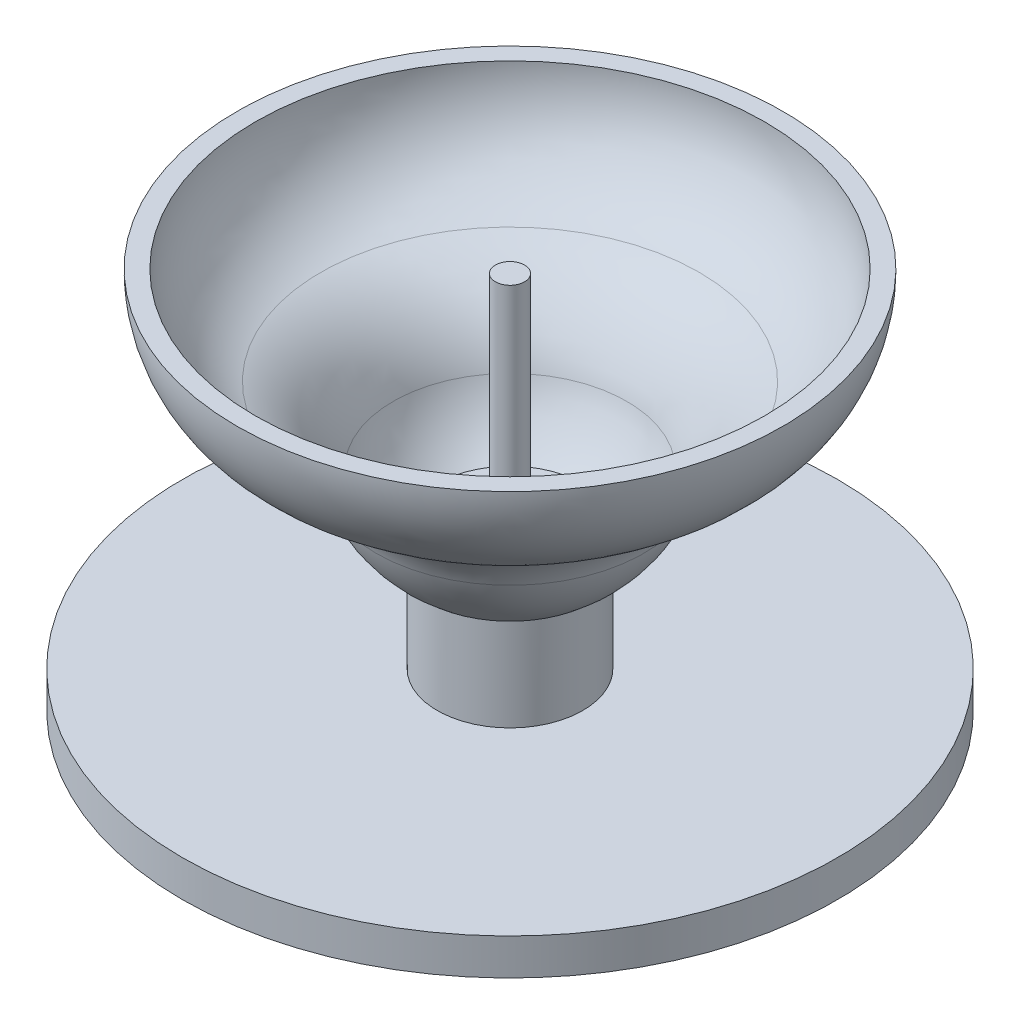
from build123d import *

# Parameters (mm, degrees)
ESQUISSE1_R                       = 90
BOSS_EXTRU_1_DEPTH                = 10
ESQUISSE2_R                       = 20
BOSS_EXTRU_2_DEPTH                = 93
ESQUISSE4_R                       = 39
ESQUISSE4_R_2                     = 36
ENL_V_MAT_EXTRU_1_DEPTH           = 1
ENL_V_MAT_EXTRU_1_DRAFT           = -30
ESQUISSE4_R_3                     = 57
ESQUISSE4_R_4                     = 54
ENL_V_MAT_EXTRU_1_PROFILE_2_DEPTH = 1
ENL_V_MAT_EXTRU_1_PROFILE_2_DRAFT = -30
ESQUISSE4_R_5                     = 75
ESQUISSE4_R_6                     = 72
ENL_V_MAT_EXTRU_1_PROFILE_3_DEPTH = 1
ENL_V_MAT_EXTRU_1_PROFILE_3_DRAFT = -30
ENL_V_START                       = -59
ESQUISSE5_R                       = 20
ENL_V_MAT_EXTRU_2_DEPTH           = 59
ESQUISSE6_R                       = 4
BOSS_EXTRU_3_DEPTH                = 60


with BuildPart() as part:
    # Esquisse1 → Boss.-Extru.1 (new body)
    with BuildSketch(Plane(origin=(0, 0, 0), x_dir=(1, 0, 0), z_dir=(0, 1, 0))):
        Circle(ESQUISSE1_R)
    extrude(amount=BOSS_EXTRU_1_DEPTH)

    # Esquisse2 → Boss.-Extru.2 (add)
    with BuildSketch(Plane(origin=(0, 10, 0), x_dir=(1, 0, 0), z_dir=(0, 1, 0))):
        Circle(ESQUISSE2_R)
    extrude(amount=BOSS_EXTRU_2_DEPTH)


with BuildPart() as enl_v_mat_extru_1_tool:
    # Esquisse4 → Enlèv. mat.-Extru.1 (with draft: the straight prism first)
    with BuildSketch(Plane.XZ):
        Circle(ESQUISSE4_R)
        Circle(ESQUISSE4_R_2, mode=Mode.SUBTRACT)
    extrude(amount=-ENL_V_MAT_EXTRU_1_DEPTH)
    # Enlèv. mat.-Extru.1: the draft: its side faces are tilted about the plane it starts from
    enl_v_mat_extru_1_sides = [enl_v_mat_extru_1_tool.faces().sort_by_distance(p)[0] for p in [
        (-39, 0.5, 0),
        (-36, 0.5, 0),
    ]]
    draft(enl_v_mat_extru_1_sides, Plane.XZ, ENL_V_MAT_EXTRU_1_DRAFT)


with BuildPart() as part_1:
    add(part.part)

    # Enlèv. mat.-Extru.1: cut by enl_v_mat_extru_1_tool
    add(enl_v_mat_extru_1_tool.part, mode=Mode.SUBTRACT)


with BuildPart() as enl_v_mat_extru_1_profile_2_tool:
    # Esquisse4 → Enlèv. mat.-Extru.1 profile 2 (with draft: the straight prism first)
    with BuildSketch(Plane.XZ):
        Circle(ESQUISSE4_R_3)
        Circle(ESQUISSE4_R_4, mode=Mode.SUBTRACT)
    extrude(amount=-ENL_V_MAT_EXTRU_1_PROFILE_2_DEPTH)
    # Enlèv. mat.-Extru.1 profile 2: the draft: its side faces are tilted about the plane it starts from
    enl_v_mat_extru_1_profile_2_sides = [enl_v_mat_extru_1_profile_2_tool.faces().sort_by_distance(p)[0] for p in [
        (-57, 0.5, 0),
        (-54, 0.5, 0),
    ]]
    draft(enl_v_mat_extru_1_profile_2_sides, Plane.XZ, ENL_V_MAT_EXTRU_1_PROFILE_2_DRAFT)


with BuildPart() as part_2:
    add(part_1.part)

    # Enlèv. mat.-Extru.1 profile 2: cut by enl_v_mat_extru_1_profile_2_tool
    add(enl_v_mat_extru_1_profile_2_tool.part, mode=Mode.SUBTRACT)


with BuildPart() as enl_v_mat_extru_1_profile_3_tool:
    # Esquisse4 → Enlèv. mat.-Extru.1 profile 3 (with draft: the straight prism first)
    with BuildSketch(Plane.XZ):
        Circle(ESQUISSE4_R_5)
        Circle(ESQUISSE4_R_6, mode=Mode.SUBTRACT)
    extrude(amount=-ENL_V_MAT_EXTRU_1_PROFILE_3_DEPTH)
    # Enlèv. mat.-Extru.1 profile 3: the draft: its side faces are tilted about the plane it starts from
    enl_v_mat_extru_1_profile_3_sides = [enl_v_mat_extru_1_profile_3_tool.faces().sort_by_distance(p)[0] for p in [
        (-75, 0.5, 0),
        (-72, 0.5, 0),
    ]]
    draft(enl_v_mat_extru_1_profile_3_sides, Plane.XZ, ENL_V_MAT_EXTRU_1_PROFILE_3_DRAFT)


with BuildPart() as part_3:
    add(part_2.part)

    # Enlèv. mat.-Extru.1 profile 3: cut by enl_v_mat_extru_1_profile_3_tool
    add(enl_v_mat_extru_1_profile_3_tool.part, mode=Mode.SUBTRACT)

    # Esquisse3 → Révolution2 (revolve)
    with BuildSketch(Plane(origin=(0, 0, 0), x_dir=(0, 0, -1), z_dir=(1, 0, 0))):
        with BuildLine():
            Line((-69.970754953, 105.094254483), (-74.970754953, 105.094254483))
            ThreePointArc((-74.970754953, 105.094254483), (-69.214189796, 86.164390325), (-53.893634743, 73.644071148))
            ThreePointArc((-53.893634743, 73.644071148), (-43.46448587, 66.535394214), (-36.80473888, 55.814004192))
            ThreePointArc((-36.80473888, 55.814004192), (-22.477497728, 37.096821257), (0, 30))
            Line((0, 30), (0, 35))
            ThreePointArc((0, 35), (-19.606403656, 41.190330611), (-32.103598704, 57.516731724))
            ThreePointArc((-32.103598704, 57.516731724), (-39.854721671, 69.995105534), (-51.992962878, 78.26872751))
            ThreePointArc((-51.992962878, 78.26872751), (-65.060675662, 88.947970814), (-69.970754953, 105.094254483))
        make_face()
    revolve(axis=Axis((0, 103, 0), (0, -1, 0)))

    # Esquisse5 → Enlèv. mat.-Extru.2 (cut)
    with BuildSketch(Plane(origin=(0, 103, 0), x_dir=(1, 0, 0), z_dir=(0, 1, 0)).offset(ENL_V_START)):
        Circle(ESQUISSE5_R)
    extrude(amount=ENL_V_MAT_EXTRU_2_DEPTH, mode=Mode.SUBTRACT)

    # Esquisse6 → Boss.-Extru.3 (add)
    with BuildSketch(Plane(origin=(0, 44, 0), x_dir=(1, 0, 0), z_dir=(0, 1, 0))):
        Circle(ESQUISSE6_R)
    extrude(amount=BOSS_EXTRU_3_DEPTH)


solid = part_3.part
